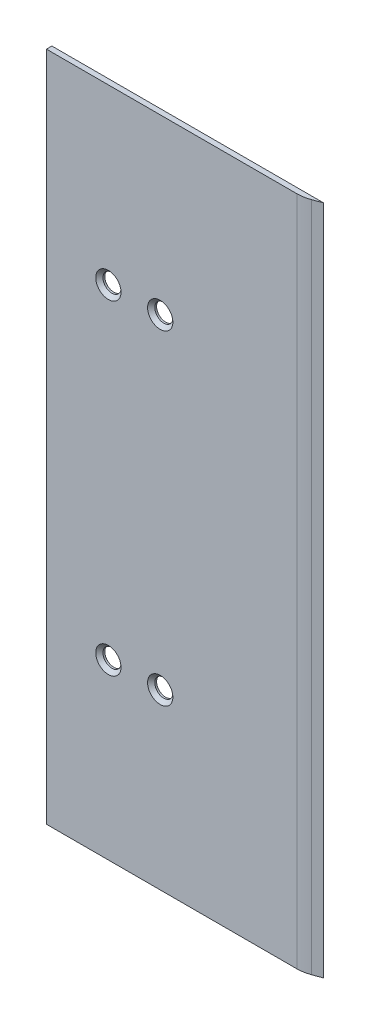
from build123d import *

# Parameters (mm, degrees)
ESQUISSE1_W        = 75.282935443
ESQUISSE1_H        = 186
ESQUISSE1_R        = 2.5
BOSS_EXTRU_1_DEPTH = 1.5
CHANFREIN3_SIZE    = 1.5
CHANFREIN3_SIZE_2  = 4.121216129
CONG_2_R           = 10
CHANFREIN4_SIZE    = 1


with BuildPart() as part:
    # Esquisse1 → Boss.-Extru.1 (new body)
    with BuildSketch(Plane.XY):
        with Locations((10.271299444, 45)):
            Rectangle(ESQUISSE1_W, ESQUISSE1_H)
        with Locations((-10.20705442, 90)):
            Circle(ESQUISSE1_R, mode=Mode.SUBTRACT)
        with Locations((4.153227182, 90)):
            Circle(ESQUISSE1_R, mode=Mode.SUBTRACT)
        with Locations((-10.20705442, 0)):
            Circle(ESQUISSE1_R, mode=Mode.SUBTRACT)
        with Locations((4.153227182, 0)):
            Circle(ESQUISSE1_R, mode=Mode.SUBTRACT)
    extrude(amount=BOSS_EXTRU_1_DEPTH)

    # Chanfrein3
    # the kernel refuses this chamfer: 4.121216129, 1.5 mm, written as the material it takes off along each edge
    with BuildSketch(Plane(origin=(47.912767165, 148.691237174, 1.5), x_dir=(0.09904090225205177, 0, -0.9950833631817484), z_dir=(0, -1, 0))) as chanfrein3_piece_1:
        Polygon((CHANFREIN3_SIZE * 0.995083363182, -CHANFREIN3_SIZE * 0.0990409022521), (-CHANFREIN3_SIZE_2 * 0.0990409022564, -CHANFREIN3_SIZE_2 * 0.995083363226), (0, 0), align=None)
    extrude(amount=207.382474348, mode=Mode.SUBTRACT)

    # Congé2
    cong_2_edges = [part.edges().sort_by_distance(p)[0] for p in [
        (43.791551035, 45, 1.5),
    ]]
    fillet(cong_2_edges, radius=CONG_2_R)

    # Chanfrein4
    chanfrein4_edges = [part.edges().sort_by_distance(p)[0] for p in [
        (-12.70705442, 90, 1.5),
        (1.653227182, 90, 1.5),
        (-12.70705442, 0, 1.5),
        (1.653227182, 0, 1.5),
    ]]
    chamfer(chanfrein4_edges, length=CHANFREIN4_SIZE)


solid = part.part
